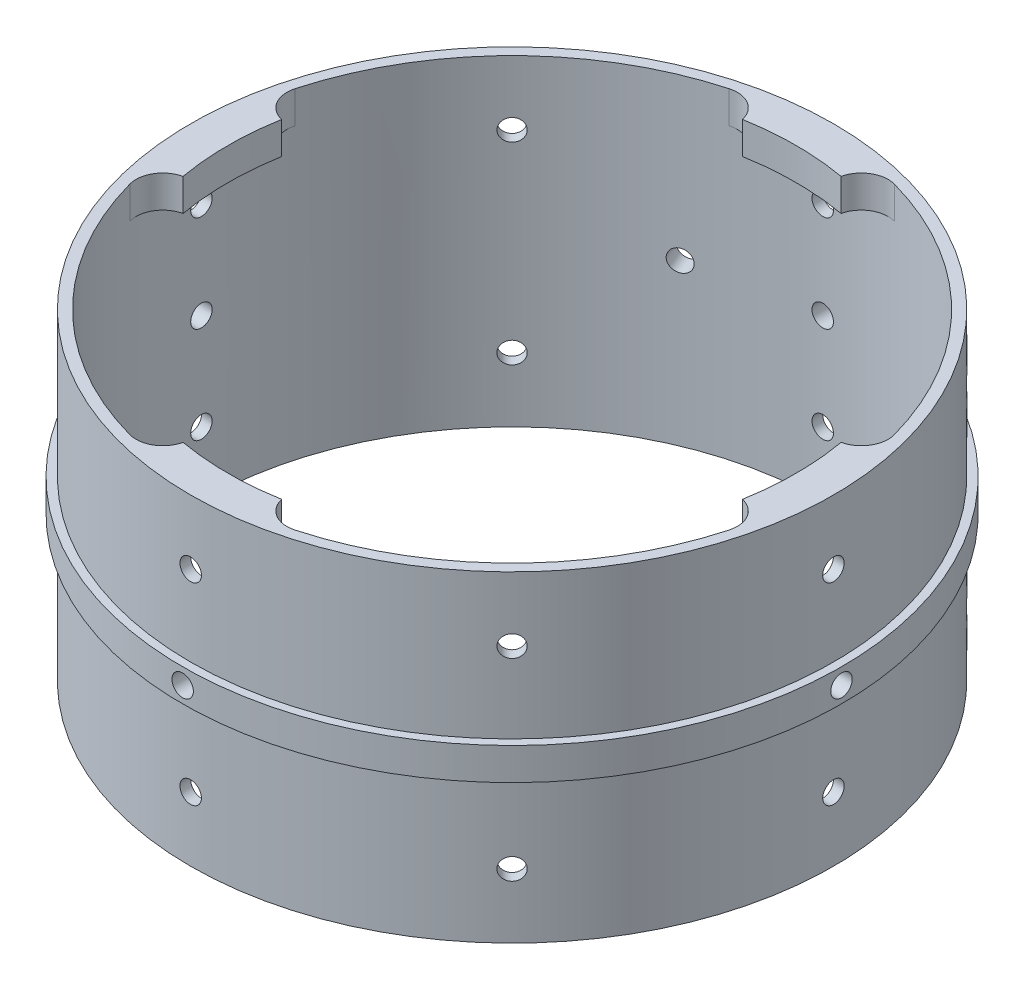
from build123d import *
from build123d.topology import SkipClean

# Parameters (mm, degrees)
CUT_EXTRUDE1_REACH      = 152.037
CUT_EXTRUDE1_END_RADIUS = 58
SKETCH2_R               = 2
CIRPATTERN1_COUNT       = 8
CUT_EXTRUDE2_REACH      = 152.037
CUT_EXTRUDE2_END_RADIUS = 58
SKETCH3_R               = 2
CIRPATTERN2_COUNT       = 4
CUT_EXTRUDE3_REACH      = 159.576
CUT_EXTRUDE3_END_RADIUS = 58
SKETCH4_R               = 2
CUT_EXTRUDE4_START      = -10
CUT_EXTRUDE4_DEPTH      = 10
CIRPATTERN3_COUNT       = 4
FILLET1_START           = 54
FILLET1_DEPTH           = 6


with BuildPart() as part:
    # Sketch1 → Revolve1 (revolve)
    with BuildSketch(Plane.XY, mode=Mode.PRIVATE) as revolve1_sk:
        Polygon((60, 0), (60, 27), (61.5, 27), (61.5, 33), (60, 33), (60, 60), (53, 60), (53, 54), (58, 54), (58, 0), align=None)
    revolve(revolve1_sk.sketch.rotate(Axis((0, 0, 0), (0, 1, 0)), 90), axis=Axis((0, 0, 0), (0, 1, 0)))

    # Cut-Extrude1: up to this cylinder (the profile starts outside it)
    cut_extrude1_end = Plane(origin=(0, 30, 0), z_dir=(0, -1, 0)) * Cylinder(CUT_EXTRUDE1_END_RADIUS, 457.074, mode=Mode.PRIVATE)
    # Sketch2 → Cut-Extrude1 (cut, up to the surface)
    with BuildSketch(Plane.XY.offset(61.5), mode=Mode.PRIVATE) as cut_extrude1_sk1:
        with Locations((0, 48)):
            Circle(SKETCH2_R)
    cut_extrude1_tool1 = extrude(cut_extrude1_sk1.sketch, amount=-CUT_EXTRUDE1_REACH, mode=Mode.PRIVATE) - cut_extrude1_end
    # Sketch2 → Cut-Extrude1 (cut, up to the surface)
    with BuildSketch(Plane.XY.offset(61.5), mode=Mode.PRIVATE) as cut_extrude1_sk2:
        with Locations((0, 12)):
            Circle(SKETCH2_R)
    cut_extrude1_tool2 = extrude(cut_extrude1_sk2.sketch, amount=-CUT_EXTRUDE1_REACH, mode=Mode.PRIVATE) - cut_extrude1_end
    cut_extrude1 = cut_extrude1_tool1.solids().sort_by_distance((0, 48, 61.5))[0] + cut_extrude1_tool2.solids().sort_by_distance((0, 12, 61.5))[0]
    add(cut_extrude1, mode=Mode.SUBTRACT)

    # CirPattern1: Cut-Extrude1 ×8 about axis
    cirpattern1_axis = Axis((0, 0, 0), (0, -1, 0))
    for i in range(1, CIRPATTERN1_COUNT):
        add(cut_extrude1.rotate(cirpattern1_axis, i * 360 / CIRPATTERN1_COUNT), mode=Mode.SUBTRACT)

    # Cut-Extrude2: up to this cylinder (the profile starts outside it)
    cut_extrude2_end = Plane(origin=(0, 30, 0), z_dir=(0, -1, 0)) * Cylinder(CUT_EXTRUDE2_END_RADIUS, 421.074, mode=Mode.PRIVATE)
    # Sketch3 → Cut-Extrude2 (cut, up to the surface)
    with BuildSketch(Plane.XY.offset(-61.5), mode=Mode.PRIVATE) as cut_extrude2_sk1:
        with Locations(Location((0, 30, 0), (0, 0, 180))):
            Circle(SKETCH3_R)
    cut_extrude2_tool1 = extrude(cut_extrude2_sk1.sketch, amount=CUT_EXTRUDE2_REACH, mode=Mode.PRIVATE) - cut_extrude2_end
    cut_extrude2 = cut_extrude2_tool1.solids().sort_by_distance((0, 30, -61.5))[0]
    add(cut_extrude2, mode=Mode.SUBTRACT)

    # CirPattern2: Cut-Extrude2 ×4 about axis
    cirpattern2_axis = Axis((0, 0, 0), (0, -1, 0))
    for i in range(1, CIRPATTERN2_COUNT):
        add(cut_extrude2.rotate(cirpattern2_axis, i * 360 / CIRPATTERN2_COUNT), mode=Mode.SUBTRACT)

    # Cut-Extrude3: up to this cylinder (the profile starts outside it)
    cut_extrude3_end = Plane(origin=(0, 30, 0), z_dir=(0, -1, 0)) * Cylinder(CUT_EXTRUDE3_END_RADIUS, 436.152, mode=Mode.PRIVATE)
    # Sketch4 → Cut-Extrude3 (cut, up to the surface)
    with BuildSketch(Plane(origin=(-23.535031, 0, -56.818591), x_dir=(0, -1, 0), z_dir=(0.3826834323650906, 0, 0.9238795325112865)), mode=Mode.PRIVATE) as cut_extrude3_sk1:
        with Locations(Location((-30, 0, 0), (0, 0, 270))):
            Circle(SKETCH4_R)
    cut_extrude3_tool1 = extrude(cut_extrude3_sk1.sketch, amount=CUT_EXTRUDE3_REACH, mode=Mode.PRIVATE) - cut_extrude3_end
    add(cut_extrude3_tool1.solids().sort_by_distance((-23.535031, 30, -56.818591))[0], mode=Mode.SUBTRACT)

    # Sketch5 → Cut-Extrude4 (cut)
    with BuildSketch(Plane(origin=(0, 60, 0), x_dir=(1, 0, 0), z_dir=(0, 1, 0)).offset(CUT_EXTRUDE4_START)):
        with BuildLine():
            ThreePointArc((-52.194811, 9.203353), (-37.476659, 37.476659), (-9.203353, 52.194811))
            Line((-9.203353, 52.194811), (-10.071594, 57.11885))
            ThreePointArc((-10.071594, 57.11885), (-41.012193, 41.012193), (-57.11885, 10.071594))
            Line((-57.11885, 10.071594), (-52.194811, 9.203353))
        make_face()
    cut_extrude4 = extrude(amount=CUT_EXTRUDE4_DEPTH, mode=Mode.SUBTRACT)

    # CirPattern3: Cut-Extrude4 ×4 about axis
    with SkipClean():  # the faces are left unmerged after this step: merging them gives an invalid solid
        cirpattern3_axis = Axis((0, 0, 0), (0, -1, 0))
        for i in range(1, CIRPATTERN3_COUNT):
            add(cut_extrude4.rotate(cirpattern3_axis, i * 360 / CIRPATTERN3_COUNT), mode=Mode.SUBTRACT)

    # Fillet1: read off the stored shape, not the designer's step
    # Fillet1 outline → Fillet1 (add)
    with BuildSketch(Plane(origin=(0, 0, 0), x_dir=(1, 0, 0), z_dir=(0, 1, 0)).offset(FILLET1_START)):
        with BuildLine():
            ThreePointArc((15.409349, -55.915579), (11.509915, -55.383597), (9.203353, -52.194811))
            Line((9.203353, -52.194811), (10.071594, -57.11885))
            ThreePointArc((10.071594, -57.11885), (12.754669, -56.580195), (15.409349, -55.915579))
        make_face()
        with BuildLine():
            ThreePointArc((52.194811, -9.203353), (55.383597, -11.509915), (55.915579, -15.409349))
            ThreePointArc((55.915579, -15.409349), (56.580195, -12.754669), (57.11885, -10.071594))
            Line((57.11885, -10.071594), (52.194811, -9.203353))
        make_face()
        with BuildLine():
            ThreePointArc((-15.409349, -55.915579), (-12.754669, -56.580195), (-10.071594, -57.11885))
            Line((-10.071594, -57.11885), (-9.203353, -52.194811))
            ThreePointArc((-9.203353, -52.194811), (-11.509915, -55.383597), (-15.409349, -55.915579))
        make_face()
        with BuildLine():
            ThreePointArc((-57.11885, -10.071594), (-56.580195, -12.754669), (-55.915579, -15.409349))
            ThreePointArc((-55.915579, -15.409349), (-55.383597, -11.509915), (-52.194811, -9.203353))
            Line((-52.194811, -9.203353), (-57.11885, -10.071594))
        make_face()
        with BuildLine():
            Line((52.194811, 9.203353), (57.11885, 10.071594))
            ThreePointArc((57.11885, 10.071594), (56.580195, 12.754669), (55.915579, 15.409349))
            ThreePointArc((55.915579, 15.409349), (55.383597, 11.509915), (52.194811, 9.203353))
        make_face()
        with BuildLine():
            ThreePointArc((-55.915579, 15.409349), (-56.580195, 12.754669), (-57.11885, 10.071594))
            Line((-57.11885, 10.071594), (-52.194811, 9.203353))
            ThreePointArc((-52.194811, 9.203353), (-55.383597, 11.509915), (-55.915579, 15.409349))
        make_face()
        with BuildLine():
            ThreePointArc((9.203353, 52.194811), (11.509915, 55.383597), (15.409349, 55.915579))
            ThreePointArc((15.409349, 55.915579), (12.754669, 56.580195), (10.071594, 57.11885))
            Line((10.071594, 57.11885), (9.203353, 52.194811))
        make_face()
        with BuildLine():
            ThreePointArc((-10.071594, 57.11885), (-12.754669, 56.580195), (-15.409349, 55.915579))
            ThreePointArc((-15.409349, 55.915579), (-11.509915, 55.383597), (-9.203353, 52.194811))
            Line((-9.203353, 52.194811), (-10.071594, 57.11885))
        make_face()
    extrude(amount=FILLET1_DEPTH)


solid = part.part
